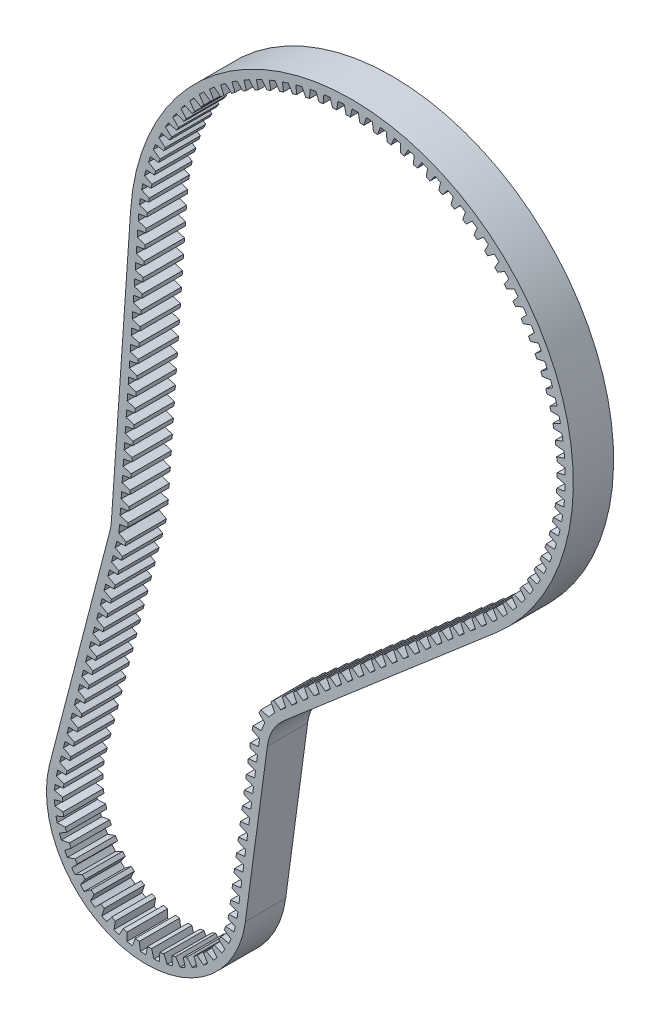
from build123d import *

# Parameters (mm, degrees)
EXTRUDE_THIN1_DEPTH = 5
BOSS_EXTRUDE1_DEPTH = 5
CRVPATTERN3_DEPTH   = 5


# Read off the part's stored shape, not the designer's step: CrvPattern3
with BuildPart() as part:
    # Sketch2 → Extrude-Thin1 (new body)
    with BuildSketch(Plane.XY):
        with BuildLine():
            Line((-29.826297558, -32.780485953), (-27.434820256, 1.892257256))
            ThreePointArc((-27.434820256, 1.892257256), (12.329017048, 24.581402292), (17.922768657, -20.857237681))
            Line((17.922768657, -20.857237681), (-8.437077677, -43.508436028))
            ThreePointArc((-8.437077677, -43.508436028), (-9.799602521, -45.196235319), (-10.472961909, -47.258207078))
            Line((-10.472961909, -47.258207078), (-13.194405781, -67.46367564))
            ThreePointArc((-13.194405781, -67.46367564), (-27.873227668, -77.976019521), (-37.485604932, -62.692715257))
            Line((-37.485604932, -62.692715257), (-30.004576967, -33.875260053))
            ThreePointArc((-30.004576967, -33.875260053), (-29.8900847, -33.332001562), (-29.826297558, -32.780485953))
        make_face()
        with BuildLine():
            Line((-28.82866773, -32.849295307), (-26.437190428, 1.823447901))
            ThreePointArc((-26.437190428, 1.823447901), (11.880689156, 23.687533117), (17.271031615, -20.098792674))
            Line((17.271031615, -20.098792674), (-9.088814719, -42.749991021))
            ThreePointArc((-9.088814719, -42.749991021), (-10.678427037, -44.719090195), (-11.46401299, -47.124723913))
            Line((-11.46401299, -47.124723913), (-14.185456862, -67.330192476))
            ThreePointArc((-14.185456862, -67.330192476), (-27.68050279, -76.994766688), (-36.517688339, -62.943986962))
            Line((-36.517688339, -62.943986962), (-29.036660374, -34.126531758))
            ThreePointArc((-29.036660374, -34.126531758), (-28.903086063, -33.492730185), (-28.82866773, -32.849295307))
        make_face(mode=Mode.SUBTRACT)
    extrude(amount=EXTRUDE_THIN1_DEPTH)

    # Sketch3 → Boss-Extrude1 (add)
    with BuildSketch(Plane.XY.offset(5)):
        Polygon((-27.670214385, -13.378348531), (-27.739187217, -14.378348531), (-27.554674216, -14.378348531), (-26.537431008, -14.197321363), (-26.502944592, -13.697321363), (-27.485701384, -13.378348531), align=None)
    extrude(amount=-BOSS_EXTRUDE1_DEPTH)

    # CrvPattern3 outline → CrvPattern3 (add)
    with BuildSketch(Plane.XY):
        Polygon((-27.680257906, -16.199118902), (-26.663014698, -16.018091734), (-26.628528282, -15.518091734), (-27.611285074, -15.199118902), align=None)
        Polygon((-26.377360903, -11.876550992), (-27.360117695, -11.55757816), (-27.429090527, -12.55757816), (-26.411847319, -12.376550992), align=None)
        Polygon((-26.251777213, -10.055780621), (-27.234534005, -9.736807789), (-27.303506837, -10.736807789), (-26.28626363, -10.555780621), align=None)
        Polygon((-26.126193524, -8.23501025), (-27.108950316, -7.916037418), (-27.177923148, -8.916037418), (-26.16067994, -8.73501025), align=None)
        Polygon((-26.000609835, -6.414239879), (-26.983366626, -6.095267047), (-27.052339458, -7.095267047), (-26.035096251, -6.914239879), align=None)
        Polygon((-25.875026145, -4.593469508), (-26.857782937, -4.274496676), (-26.926755769, -5.274496676), (-25.909512561, -5.093469508), align=None)
        Polygon((-25.749442456, -2.772699137), (-26.732199248, -2.453726305), (-26.80117208, -3.453726305), (-25.783928872, -3.272699137), align=None)
        Polygon((-25.623858766, -0.951928767), (-26.606615558, -0.632955934), (-26.67558839, -1.632955934), (-25.658345182, -1.451928767), align=None)
        Polygon((-25.498275077, 0.868841604), (-26.481031869, 1.187814437), (-26.550004701, 0.187814437), (-25.532761493, 0.368841604), align=None)
        with BuildLine():
            Line((-25.361970648, 2.638694602), (-26.331862427, 2.980439747))
            ThreePointArc((-26.331862427, 2.980439747), (-26.383410467, 2.483073122), (-26.425564894, 1.984822418))
            Line((-26.425564894, 1.984822418), (-25.408908987, 2.139709527))
            Line((-25.408908987, 2.139709527), (-25.361970648, 2.638694602))
        make_face()
        with BuildLine():
            Line((-25.131142457, 4.314851462), (-26.07623503, 4.720165953))
            ThreePointArc((-26.07623503, 4.720165953), (-26.160654158, 4.22731286), (-26.235758984, 3.732954665))
            Line((-26.235758984, 3.732954665), (-25.211069366, 3.820077774))
            Line((-25.211069366, 3.820077774), (-25.131142457, 4.314851462))
        make_face()
        with BuildLine():
            Line((-24.789662351, 5.972010118), (-25.705794494, 6.439109363))
            ThreePointArc((-25.705794494, 6.439109363), (-25.822713014, 5.952939825), (-25.930437554, 5.464650788))
            Line((-25.930437554, 5.464650788), (-24.902225913, 5.483626296))
            Line((-24.902225913, 5.483626296), (-24.789662351, 5.972010118))
        make_face()
        with BuildLine():
            Line((-24.33903386, 7.602874133), (-25.222171862, 8.129701504))
            ThreePointArc((-25.222171862, 8.129701504), (-25.371074984, 7.652356115), (-25.510944929, 7.172286163))
            Line((-25.510944929, 7.172286163), (-24.483738459, 7.123030521))
            Line((-24.483738459, 7.123030521), (-24.33903386, 7.602874133))
        make_face()
        with BuildLine():
            Line((-23.781241092, 9.200262847), (-24.627496513, 9.784498733))
            ThreePointArc((-24.627496513, 9.784498733), (-24.807728621, 9.318079235), (-24.979128126, 8.848342107))
            Line((-24.979128126, 8.848342107), (-23.957449598, 8.731072187))
            Line((-23.957449598, 8.731072187), (-23.781241092, 9.200262847))
        make_face()
        with BuildLine():
            Line((-23.118739998, 10.757142988), (-23.924386793, 11.39621501))
            ThreePointArc((-23.924386793, 11.39621501), (-24.135154327, 10.94277504), (-24.337328724, 10.485438978))
            Line((-24.337328724, 10.485438978), (-23.325676567, 10.300671116))
            Line((-23.325676567, 10.300671116), (-23.118739998, 10.757142988))
        make_face()
        with BuildLine():
            Line((-22.354447556, 12.266659644), (-23.115938478, 12.957753982))
            ThreePointArc((-23.115938478, 12.957753982), (-23.356313434, 12.519290026), (-23.588372553, 12.076368672))
            Line((-23.588372553, 12.076368672), (-22.591201051, 11.824916398))
            Line((-22.591201051, 11.824916398), (-22.354447556, 12.266659644))
        make_face()
        with BuildLine():
            Line((-21.49172893, 13.722166445), (-22.205711151, 14.462240223))
            ThreePointArc((-22.205711151, 14.462240223), (-22.474635162, 14.040682829), (-22.735557251, 13.614126357))
            Line((-22.735557251, 13.614126357), (-21.757256931, 13.297096811))
            Line((-21.757256931, 13.297096811), (-21.49172893, 13.722166445))
        make_face()
        with BuildLine():
            Line((-20.534382654, 15.117254823), (-21.197712524, 15.903049511))
            ThreePointArc((-21.197712524, 15.903049511), (-21.494001523, 15.500254788), (-21.782637748, 15.091941318))
            Line((-21.782637748, 15.091941318), (-20.827516046, 14.710730374))
            Line((-20.827516046, 14.710730374), (-20.534382654, 15.117254823))
        make_face()
        with BuildLine():
            Line((-19.486623904, 16.445782231), (-20.096380794, 17.273837992))
            ThreePointArc((-20.096380794, 17.273837992), (-20.418730227, 16.891579437), (-20.733809728, 16.503306764))
            Line((-20.733809728, 16.503306764), (-19.806072026, 16.059592886))
            Line((-19.806072026, 16.059592886), (-19.486623904, 16.445782231))
        make_face()
        with BuildLine():
            Line((-18.35306594, 17.701899191), (-18.906565104, 18.568570111))
            ThreePointArc((-18.906565104, 18.568570111), (-19.253555673, 18.208530801), (-19.593691161, 17.842008482))
            Line((-19.593691161, 17.842008482), (-18.697422269, 17.337745334))
            Line((-18.697422269, 17.337745334), (-18.35306594, 17.701899191))
        make_face()
        with BuildLine():
            Line((-17.138699796, 18.880075044), (-17.633504187, 19.781545189))
            ThreePointArc((-17.633504187, 19.781545189), (-18.0036081, 19.445310369), (-18.367301965, 19.102152195))
            Line((-18.367301965, 19.102152195), (-17.506448137, 18.539560037))
            Line((-17.506448137, 18.539560037), (-17.138699796, 18.880075044))
        make_face()
        with BuildLine():
            Line((-15.8488723, 19.975122306), (-16.282803306, 20.907422521))
            ThreePointArc((-16.282803306, 20.907422521), (-16.674391002, 20.596472627), (-17.060041908, 20.278189516))
            Line((-17.060041908, 20.278189516), (-16.238393467, 19.65974543))
            Line((-16.238393467, 19.65974543), (-15.8488723, 19.975122306))
        make_face()
        with BuildLine():
            Line((-14.489262539, 20.982219506), (-14.860409569, 21.941244892))
            ThreePointArc((-14.860409569, 21.941244892), (-15.271756896, 21.65694903), (-15.67766683, 21.364942377))
            Line((-15.67766683, 21.364942377), (-14.898841476, 20.693369359))
            Line((-14.898841476, 20.693369359), (-14.489262539, 20.982219506))
        make_face()
        with BuildLine():
            Line((-13.065856846, 21.896932416), (-13.372585748, 22.878460403))
            ThreePointArc((-13.372585748, 22.878460403), (-13.801881551, 22.622070322), (-14.226263299, 22.357625825))
            Line((-14.226263299, 22.357625825), (-13.493690185, 21.635880799))
            Line((-13.493690185, 21.635880799), (-13.065856846, 21.896932416))
        make_face()
        with BuildLine():
            Line((-11.584922448, 22.715233572), (-11.8258827, 23.714942512))
            ThreePointArc((-11.8258827, 23.714942512), (-12.271236799, 23.487587092), (-12.712221817, 23.251869096))
            Line((-12.712221817, 23.251869096), (-12.029126448, 22.48312989))
            Line((-12.029126448, 22.48312989), (-11.584922448, 22.715233572))
        make_face()
        with BuildLine():
            Line((-10.052979869, 23.433520011), (-10.227110528, 24.447008206))
            ThreePointArc((-10.227110528, 24.447008206), (-10.686562037, 24.249688489), (-11.142208678, 24.043734855))
            Line((-11.142208678, 24.043734855), (-10.511598709, 23.231386212))
            Line((-10.511598709, 23.231386212), (-10.052979869, 23.433520011))
        make_face()
        with BuildLine():
            Line((-8.476774222, 24.048629132), (-8.583308594, 25.071434214))
            ThreePointArc((-8.583308594, 25.071434214), (-9.054834558, 24.905018994), (-9.523136617, 24.729736532))
            Line((-9.523136617, 24.729736532), (-8.947788612, 23.877355208))
            Line((-8.947788612, 23.877355208), (-8.476774222, 24.048629132))
        make_face()
        with BuildLine():
            Line((-6.863245508, 24.557852623), (-6.901714525, 25.585471201))
            ThreePointArc((-6.901714525, 25.585471201), (-7.383238824, 25.450693202), (-7.862134378, 25.306853677))
            Line((-7.862134378, 25.306853677), (-7.344581581, 24.418192688))
            Line((-7.344581581, 24.418192688), (-6.863245508, 24.557852623))
        make_face()
        with BuildLine():
            Line((-5.219498062, 24.958948382), (-5.189732345, 25.986855873))
            ThreePointArc((-5.189732345, 25.986855873), (-5.679134838, 25.884308518), (-6.166515319, 25.772545253))
            Line((-6.166515319, 25.772545253), (-5.709036506, 24.851517357))
            Line((-5.709036506, 24.851517357), (-5.219498062, 24.958948382))
        make_face()
        with BuildLine():
            Line((-3.552769271, 25.250150393), (-3.454899879, 26.27382094))
            ThreePointArc((-3.454899879, 26.27382094), (-3.950025736, 26.203955745), (-4.443745217, 26.12476083))
            Line((-4.443745217, 26.12476083), (-4.048354657, 25.175421294))
            Line((-4.048354657, 25.175421294), (-3.552769271, 25.250150393))
        make_face()
        with BuildLine():
            Line((-1.870397708, 25.430176499), (-1.704855557, 26.445102902))
            ThreePointArc((-1.704855557, 26.445102902), (-2.20352475, 26.40822748), (-2.701409394, 26.361949611))
            Line((-2.701409394, 26.361949611), (-2.369847984, 25.388478357))
            Line((-2.369847984, 25.388478357), (-1.870397708, 25.430176499))
        make_face()
        with BuildLine():
            Line((-0.179790822, 25.498234049), (0.052695209, 26.499947607))
            ThreePointArc((0.052695209, 26.499947607), (-0.447321688, 26.496224321), (-0.94717932, 26.483067257))
            Line((-0.94717932, 26.483067257), (-0.680906918, 25.48975046))
            Line((-0.680906918, 25.48975046), (-0.179790822, 25.498234049))
        make_face()
        with BuildLine():
            Line((1.511607679, 25.454023387), (1.810013959, 26.438113576))
            ThreePointArc((1.810013959, 26.438113576), (1.310850922, 26.467558819), (0.811221166, 26.48758049))
            Line((0.811221166, 26.48758049), (1.011032167, 25.478791704))
            Line((1.011032167, 25.478791704), (1.511607679, 25.454023387))
        make_face()
        with BuildLine():
            Line((3.196350603, 25.297739171), (3.559363254, 26.259873062))
            ThreePointArc((3.559363254, 26.259873062), (3.063251882, 26.322357187), (2.566049862, 26.375469438))
            Line((2.566049862, 26.375469438), (2.698519698, 25.355650341))
            Line((2.698519698, 25.355650341), (3.196350603, 25.297739171))
        make_face()
        with BuildLine():
            Line((4.867020058, 25.030069518), (5.293040745, 25.966010854))
            ThreePointArc((5.293040745, 25.966010854), (4.802165405, 26.061258746), (4.309580291, 26.147227725))
            Line((4.309580291, 26.147227725), (4.374125701, 25.120868558))
            Line((4.374125701, 25.120868558), (4.867020058, 25.030069518))
        make_face()
        with BuildLine():
            Line((6.516260123, 24.652192973), (7.003413083, 25.557820822))
            ThreePointArc((7.003413083, 25.557820822), (6.519935091, 25.685413106), (6.034135725, 25.803860293))
            Line((6.034135725, 25.803860293), (6.030472517, 24.775480096))
            Line((6.030472517, 24.775480096), (6.516260123, 24.652192973))
        make_face()
        with BuildLine():
            Line((8.136809225, 24.165773317), (8.682949534, 25.037100219))
            ThreePointArc((8.682949534, 25.037100219), (8.208997632, 25.196475108), (7.73212298, 25.346878984))
            Line((7.73212298, 25.346878984), (7.660267283, 24.321005693))
            Line((7.660267283, 24.321005693), (8.136809225, 24.165773317))
        make_face()
        with BuildLine():
            Line((9.721532119, 23.572952246), (10.324255133, 24.406141767))
            ThreePointArc((10.324255133, 24.406141767), (9.861916123, 24.596597536), (9.396065854, 24.778295875))
            Line((9.396065854, 24.778295875), (9.256334046, 23.75944639))
            Line((9.256334046, 23.75944639), (9.721532119, 23.572952246))
        make_face()
        with BuildLine():
            Line((11.263451303, 22.876339941), (11.920103244, 23.667723563))
            ThreePointArc((11.920103244, 23.667723563), (11.471412795, 23.88842164), (11.018638038, 24.100614427))
            Line((11.018638038, 24.100614427), (10.811645357, 23.093274723))
            Line((10.811645357, 23.093274723), (11.263451303, 22.876339941))
        make_face()
        with BuildLine():
            Line((12.755777737, 22.07900357), (13.46346738, 22.825096848))
            ThreePointArc((13.46346738, 22.825096848), (13.030401067, 23.075065504), (12.59269538, 23.316818459))
            Line((12.59269538, 23.316818459), (12.31935321, 22.325423831))
            Line((12.31935321, 22.325423831), (12.755777737, 22.07900357))
        make_face()
        with BuildLine():
            Line((14.191940738, 21.184453791), (14.94755214, 21.88197169))
            ThreePointArc((14.94755214, 21.88197169), (14.532016746, 22.160110318), (14.111307338, 22.430359008))
            Line((14.111307338, 22.430359008), (13.772819199, 21.459274547))
            Line((13.772819199, 21.459274547), (14.191940738, 21.184453791))
        make_face()
        with BuildLine():
            Line((15.56561691, 20.196629287), (16.365823128, 20.84250065))
            ThreePointArc((16.365823128, 20.84250065), (15.969648246, 21.147584611), (15.567787493, 21.445139136))
            Line((15.567787493, 21.445139136), (15.165643741, 20.498640508))
            Line((15.165643741, 20.498640508), (15.56561691, 20.196629287))
        make_face()
        with BuildLine():
            Line((16.870757982, 19.119879431), (17.712035726, 19.711260499))
            ThreePointArc((17.712035726, 19.711260499), (17.336965707, 20.041946514), (16.955722993, 20.365496748))
            Line((16.955722993, 20.365496748), (16.491694259, 19.447751367))
            Line((16.491694259, 19.447751367), (16.870757982, 19.119879431))
        make_face()
        with BuildLine():
            Line((18.101617447, 17.958945129), (18.980262586, 18.493232064))
            ThreePointArc((18.980262586, 18.493232064), (18.627948855, 18.84806413), (18.269002785, 19.196185487))
            Line((18.269002785, 19.196185487), (17.745132178, 18.311234167))
            Line((17.745132178, 18.311234167), (18.101617447, 17.958945129))
        make_face()
        with BuildLine():
            Line((19.252775853, 16.718937953), (20.164919732, 17.1937783))
            ThreePointArc((20.164919732, 17.1937783), (19.836913519, 17.571194098), (19.501844525, 17.942353807))
            Line((19.501844525, 17.942353807), (18.920438637, 17.094092972))
            Line((18.920438637, 17.094092972), (19.252775853, 16.718937953))
        make_face()
        with BuildLine():
            Line((20.319164675, 15.405317629), (21.260791141, 15.818620675))
            ThreePointArc((21.260791141, 15.818620675), (20.958536652, 16.216958451), (20.648820035, 16.609522303))
            Line((20.648820035, 16.609522303), (20.012438785, 15.801686828))
            Line((20.012438785, 15.801686828), (20.319164675, 15.405317629))
        make_face()
        with BuildLine():
            Line((21.296088623, 14.023868002), (22.263051714, 14.373813982))
            ThreePointArc((22.263051714, 14.373813982), (21.987879768, 14.791319863), (21.704879206, 15.203559407))
            Line((21.704879206, 15.203559407), (21.016324568, 14.439706175))
            Line((21.016324568, 14.439706175), (21.296088623, 14.023868002))
        make_face()
        with BuildLine():
            Line((22.17924632, 12.580671565), (23.167288518, 12.865719674))
            ThreePointArc((23.167288518, 12.865719674), (22.920410693, 13.30055539), (22.66537223, 13.730655544))
            Line((22.66537223, 13.730655544), (21.927675895, 13.014147786))
            Line((21.927675895, 13.014147786), (22.17924632, 12.580671565))
        make_face()
        with BuildLine():
            Line((22.964749242, 11.082082684), (23.969520216, 11.300977862))
            ThreePointArc((23.969520216, 11.300977862), (23.752023509, 11.751228839), (23.526070075, 12.197295881))
            Line((23.526070075, 12.197295881), (22.742480106, 11.531288366))
            Line((22.742480106, 11.531288366), (22.964749242, 11.082082684))
        make_face()
        with BuildLine():
            Line((23.649138834, 9.534699616), (24.666214598, 9.686478071))
            ThreePointArc((24.666214598, 9.686478071), (24.479056643, 10.150161864), (24.283183107, 10.610231769))
            Line((24.283183107, 10.610231769), (23.457149635, 9.997656914))
            Line((23.457149635, 9.997656914), (23.649138834, 9.534699616))
        make_face()
        with BuildLine():
            Line((24.229401743, 7.945335457), (25.254304133, 8.029328911))
            ThreePointArc((25.254304133, 8.029328911), (25.098308983, 8.50440393), (24.933377771, 8.97645102))
            Line((24.933377771, 8.97645102), (24.068537804, 8.420005981))
            Line((24.068537804, 8.420005981), (24.229401743, 7.945335457))
        make_face()
        with BuildLine():
            Line((24.702983083, 6.320988145), (25.731199474, 6.336826778))
            ThreePointArc((25.731199474, 6.336826778), (25.607053972, 6.821201276), (25.473791274, 7.303147138))
            Line((25.473791274, 7.303147138), (24.573952686, 6.80528193))
            Line((24.573952686, 6.80528193), (24.702983083, 6.320988145))
        make_face()
        with BuildLine():
            Line((25.067797685, 4.66880965), (26.094800861, 4.616423724))
            ThreePointArc((26.094800861, 4.616423724), (26.003051618, 5.107965011), (25.902044186, 5.597687645))
            Line((25.902044186, 5.597687645), (24.971168948, 5.160594359))
            Line((24.971168948, 5.160594359), (25.067797685, 4.66880965))
        make_face()
        with BuildLine():
            Line((25.322239278, 2.99607448), (26.343507365, 2.875694649))
            ThreePointArc((26.343507365, 2.875694649), (26.28455835, 3.372238477), (26.216250918, 3.867581646))
            Line((26.216250918, 3.867581646), (25.258437654, 3.493184796))
            Line((25.258437654, 3.493184796), (25.322239278, 2.99607448))
        make_face()
        with BuildLine():
            Line((25.46518756, 1.310147654), (26.476223935, 1.122303948))
            ThreePointArc((26.476223935, 1.122303948), (26.4503347, 1.621664046), (26.415028024, 2.120446763))
            Line((26.415028024, 2.120446763), (25.434493968, 1.810394809))
            Line((25.434493968, 1.810394809), (25.46518756, 1.310147654))
        make_face()
        with BuildLine():
            Line((25.496013133, -0.381547725), (26.492366223, -0.636028234))
            ThreePointArc((26.492366223, -0.636028234), (26.499650757, -0.136050539), (26.497500293, 0.363975596))
            Line((26.497500293, 0.363975596), (25.498562715, 0.119633691))
            Line((25.498562715, 0.119633691), (25.496013133, -0.381547725))
        make_face()
        with BuildLine():
            Line((25.414580272, -2.071563158), (26.391863155, -2.391559997))
            ThreePointArc((26.391863155, -2.391559997), (26.432289385, -1.893166097), (26.4633046, -1.394098149))
            Line((26.4633046, -1.394098149), (25.450361803, -1.571654172))
            Line((25.450361803, -1.571654172), (25.414580272, -2.071563158))
        make_face()
        with BuildLine():
            Line((25.221247526, -3.75245754), (26.175157244, -4.13656177))
            ThreePointArc((26.175157244, -4.13656177), (26.248547174, -3.641946083), (26.312591509, -3.146033708))
            Line((26.312591509, -3.146033708), (25.29010346, -3.256022073))
            Line((25.29010346, -3.256022073), (25.221247526, -3.75245754))
        make_face()
        with BuildLine():
            Line((24.916866133, -5.416829927), (25.843202641, -5.863350344))
            ThreePointArc((25.843202641, -5.863350344), (25.949233137, -5.374690652), (26.046024606, -4.884117343))
            Line((26.046024606, -4.884117343), (25.018493299, -4.926053774))
            Line((25.018493299, -4.926053774), (24.916866133, -5.416829927))
        make_face()
        with BuildLine():
            Line((24.502776279, -7.05735212), (25.397460937, -7.564322704))
            ThreePointArc((25.397460937, -7.564322704), (25.535665148, -7.083770567), (25.66477758, -6.600696308))
            Line((25.66477758, -6.600696308), (24.636727216, -6.57439616))
            Line((24.636727216, -6.57439616), (24.502776279, -7.05735212))
        make_face()
        with BuildLine():
            Line((23.980801194, -8.666800934), (24.839894722, -9.231989504))
            ThreePointArc((24.839894722, -9.231989504), (25.009664139, -8.761660783), (25.170529055, -8.28821254))
            Line((25.170529055, -8.28821254), (24.146486117, -8.193791611))
            Line((24.146486117, -8.193791611), (23.980801194, -8.666800934))
        make_face()
        with BuildLine():
            Line((23.353239123, -10.238089997), (24.17295895, -10.859008039))
            ThreePointArc((24.17295895, -10.859008039), (24.37354608, -10.400973583), (24.565455195, -9.939235939))
            Line((24.565455195, -9.939235939), (23.549928525, -9.777109963))
            Line((23.549928525, -9.777109963), (23.353239123, -10.238089997))
        make_face()
        with BuildLine():
            Line((22.62285321, -11.764300956), (23.399590126, -12.43821458))
            ThreePointArc((23.399590126, -12.43821458), (23.630111789, -11.994491104), (23.852220131, -11.546497081))
            Line((23.852220131, -11.546497081), (22.849681071, -11.317379896))
            Line((22.849681071, -11.317379896), (22.62285321, -11.764300956))
        make_face()
        with BuildLine():
            Line((21.792859328, -13.238713934), (22.523193377, -13.962655912))
            ThreePointArc((22.523193377, -13.962655912), (22.78263459, -13.535197122), (23.03396422, -13.102919229))
            Line((23.03396422, -13.102919229), (22.048826931, -12.807819632))
            Line((22.048826931, -12.807819632), (21.792859328, -13.238713934))
        make_face()
        with BuildLine():
            Line((20.866911925, -14.654837121), (21.547627459, -15.425619951))
            ThreePointArc((21.547627459, -15.425619951), (21.834845909, -15.01630794), (22.114290228, -14.601649487))
            Line((22.114290228, -14.601649487), (21.150892248, -14.241866797))
            Line((21.150892248, -14.241866797), (20.866911925, -14.654837121))
        make_face()
        with BuildLine():
            Line((19.849087928, -16.006435355), (20.477187772, -16.820665295))
            ThreePointArc((20.477187772, -16.820665295), (20.79091884, -16.431302255), (21.09724746, -16.036088975))
            Line((21.09724746, -16.036088975), (20.159830613, -15.613207307))
            Line((20.159830613, -15.613207307), (19.849087928, -16.006435355))
        make_face()
        with BuildLine():
            Line((18.743868796, -17.287557575), (19.316587437, -18.141649588))
            ThreePointArc((19.316587437, -18.141649588), (19.655449773, -17.773949877), (19.987313936, -17.399921886))
            Line((19.987313936, -17.399921886), (19.080005648, -16.91580318))
            Line((19.080005648, -16.91580318), (18.743868796, -17.287557575))
        make_face()
        with BuildLine():
            Line((17.556120786, -18.492563027), (18.070936557, -19.382756562))
            ThreePointArc((18.070936557, -19.382756562), (18.433438156, -19.038339154), (18.78937667, -18.687143291))
            Line((18.78937667, -18.687143291), (17.916171801, -18.143919112))
            Line((17.916171801, -18.143919112), (17.556120786, -18.492563027))
        make_face()
        with BuildLine():
            Line((16.282072413, -19.626992536), (16.745296124, -20.55056082))
            Line((16.745296124, -20.55056082), (17.271031615, -20.098792674))
            ThreePointArc((17.271031615, -20.098792674), (17.387825723, -19.997837799), (17.504029728, -19.896204243))
            Line((17.504029728, -19.896204243), (16.662195875, -19.300349816))
            Line((16.662195875, -19.300349816), (16.282072413, -19.626992536))
        make_face()
        Polygon((14.897837341, -20.816475311), (15.361061052, -21.740043595), (16.121307975, -21.086758153), (15.277960803, -20.489832591), align=None)
        Polygon((13.513602269, -22.005958087), (13.97682598, -22.92952637), (14.737072903, -22.276240929), (13.893725731, -21.679315366), align=None)
        Polygon((12.129367198, -23.195440862), (12.592590908, -24.119009145), (13.352837831, -23.465723704), (12.509490659, -22.868798141), align=None)
        Polygon((10.745132126, -24.384923637), (11.208355836, -25.30849192), (11.968602759, -24.655206479), (11.125255587, -24.058280916), align=None)
        Polygon((9.360897054, -25.574406412), (9.824120764, -26.497974696), (10.584367687, -25.844689254), (9.741020515, -25.247763692), align=None)
        Polygon((7.976661982, -26.763889188), (8.439885693, -27.687457471), (9.200132615, -27.03417203), (8.356785443, -26.437246467), align=None)
        Polygon((6.59242691, -27.953371963), (7.055650621, -28.876940246), (7.815897544, -28.223654805), (6.972550372, -27.626729242), align=None)
        Polygon((5.208191838, -29.142854738), (5.671415549, -30.066423021), (6.431662472, -29.41313758), (5.5883153, -28.816212017), align=None)
        Polygon((3.823956766, -30.332337513), (4.287180477, -31.255905796), (5.0474274, -30.602620355), (4.204080228, -30.005694793), align=None)
        Polygon((2.439721695, -31.521820288), (2.902945405, -32.445388572), (3.663192328, -31.79210313), (2.819845156, -31.195177568), align=None)
        Polygon((1.055486623, -32.711303064), (1.518710333, -33.634871347), (2.278957256, -32.981585906), (1.435610084, -32.384660343), align=None)
        Polygon((-0.328748449, -33.900785839), (0.134475261, -34.824354122), (0.894722184, -34.171068681), (0.051375012, -33.574143118), align=None)
        Polygon((-1.712983521, -35.090268614), (-1.24975981, -36.013836897), (-0.489512887, -35.360551456), (-1.332860059, -34.763625893), align=None)
        Polygon((-3.097218593, -36.279751389), (-2.633994882, -37.203319673), (-1.873747959, -36.550034231), (-2.717095131, -35.953108669), align=None)
        Polygon((-4.481453665, -37.469234164), (-4.018229954, -38.392802448), (-3.257983031, -37.739517006), (-4.101330203, -37.142591444), align=None)
        Polygon((-5.865688736, -38.65871694), (-5.402465026, -39.582285223), (-4.642218103, -38.928999782), (-5.485565275, -38.332074219), align=None)
        Polygon((-7.249923808, -39.848199715), (-6.786700098, -40.771767998), (-6.026453175, -40.118482557), (-6.869800347, -39.521556994), align=None)
        Polygon((-8.63415888, -41.03768249), (-8.17093517, -41.961250773), (-7.410688247, -41.307965332), (-8.254035419, -40.711039769), align=None)
        with BuildLine():
            Line((-9.562373934, -43.17095902), (-9.549487111, -43.183538218))
            ThreePointArc((-9.549487111, -43.183538218), (-9.324050949, -42.961558011), (-9.088814719, -42.749991021))
            Line((-9.088814719, -42.749991021), (-8.808656042, -42.509248732))
            Line((-8.808656042, -42.509248732), (-8.81450316, -42.503541193))
            Line((-8.81450316, -42.503541193), (-9.668888682, -41.922524876))
            Line((-9.668888682, -41.922524876), (-10.042824069, -42.25623379))
            Line((-10.042824069, -42.25623379), (-9.562373934, -43.17095902))
        make_face()
        with BuildLine():
            Line((-10.79526048, -44.903629382), (-10.779197625, -44.911771317))
            ThreePointArc((-10.779197625, -44.911771317), (-10.537807086, -44.472177618), (-10.265561918, -44.050995258))
            Line((-10.265561918, -44.050995258), (-10.281623552, -44.042853942))
            Line((-10.281623552, -44.042853942), (-11.270808224, -43.744410874))
            Line((-11.270808224, -43.744410874), (-11.527626688, -44.174798593))
            Line((-11.527626688, -44.174798593), (-10.79526048, -44.903629382))
        make_face()
        with BuildLine():
            Line((-11.452589604, -46.926022577), (-11.434825542, -46.928979691))
            ThreePointArc((-11.434825542, -46.928979691), (-11.336180987, -46.437267108), (-11.202583831, -45.95387926))
            Line((-11.202583831, -45.95387926), (-11.220346543, -45.950922371))
            Line((-11.220346543, -45.950922371), (-12.253507514, -45.962454361))
            Line((-12.253507514, -45.962454361), (-12.369629045, -46.450004464))
            Line((-12.369629045, -46.450004464), (-11.452589604, -46.926022577))
        make_face()
        Polygon((-12.654617527, -48.455034819), (-11.694661977, -48.83718652), (-11.560861683, -47.843780896), (-12.58771738, -47.958332008), align=None)
        Polygon((-12.898237139, -50.263798345), (-11.938281589, -50.645950045), (-11.804481295, -49.652544422), (-12.831336992, -49.767095533), align=None)
        Polygon((-13.141856751, -52.07256187), (-12.181901201, -52.454713571), (-12.048100907, -51.461307947), (-13.074956604, -51.575859059), align=None)
        Polygon((-13.385476363, -53.881325396), (-12.425520813, -54.263477096), (-12.291720519, -53.270071473), (-13.318576216, -53.384622584), align=None)
        Polygon((-13.629095975, -55.690088921), (-12.669140425, -56.072240622), (-12.535340131, -55.078834998), (-13.562195828, -55.19338611), align=None)
        Polygon((-13.872715587, -57.498852447), (-12.912760037, -57.881004147), (-12.778959743, -56.887598524), (-13.80581544, -57.002149635), align=None)
        Polygon((-14.116335199, -59.307615972), (-13.15637965, -59.689767673), (-13.022579355, -58.696362049), (-14.049435052, -58.810913161), align=None)
        Polygon((-14.359954811, -61.116379498), (-13.399999262, -61.498531198), (-13.266198967, -60.505125575), (-14.293054664, -60.619676686), align=None)
        Polygon((-14.603574423, -62.925143024), (-13.643618874, -63.307294724), (-13.509818579, -62.313889101), (-14.536674276, -62.428440212), align=None)
        Polygon((-14.847194035, -64.733906549), (-13.887238486, -65.11605825), (-13.753438191, -64.122652626), (-14.780293888, -64.237203737), align=None)
        Polygon((-15.090813647, -66.542670075), (-14.130858098, -66.924821775), (-13.997057803, -65.931416152), (-15.0239135, -66.045967263), align=None)
        with BuildLine():
            Line((-15.360886771, -68.19761526), (-14.441824302, -68.644457037))
            ThreePointArc((-14.441824302, -68.644457037), (-14.328382124, -68.158952866), (-14.236276992, -67.668952792))
            Line((-14.236276992, -67.668952792), (-15.25760431, -67.70718479))
            Line((-15.25760431, -67.70718479), (-15.360886771, -68.19761526))
        make_face()
        with BuildLine():
            Line((-15.820710183, -69.656299608), (-14.977116079, -70.23309453))
            ThreePointArc((-14.977116079, -70.23309453), (-14.793699173, -69.769476511), (-14.630729269, -69.298282031))
            Line((-14.630729269, -69.298282031), (-15.646620683, -69.186318588))
            Line((-15.646620683, -69.186318588), (-15.820710183, -69.656299608))
        make_face()
        with BuildLine():
            Line((-16.489484264, -71.031777279), (-15.739600736, -71.726052506))
            ThreePointArc((-15.739600736, -71.726052506), (-15.490175383, -71.2943461), (-15.259864832, -70.852146509))
            Line((-15.259864832, -70.852146509), (-16.248352304, -70.592408766))
            Line((-16.248352304, -70.592408766), (-16.489484264, -71.031777279))
        make_face()
        with BuildLine():
            Line((-17.352747178, -72.294304402), (-16.712790005, -73.091046651))
            ThreePointArc((-16.712790005, -73.091046651), (-16.402749875, -72.700587247), (-16.110079005, -72.296944844))
            Line((-16.110079005, -72.296944844), (-17.049787091, -71.895049473))
            Line((-17.049787091, -71.895049473), (-17.352747178, -72.294304402))
        make_face()
        with BuildLine():
            Line((-18.391831388, -73.416579592), (-17.875639255, -74.298559795))
            ThreePointArc((-17.875639255, -74.298559795), (-17.51168878, -73.957790841), (-17.162986421, -73.601434148))
            Line((-17.162986421, -73.601434148), (-18.033594503, -73.066071893))
            Line((-18.033594503, -73.066071893), (-18.391831388, -73.416579592))
        make_face()
        with BuildLine():
            Line((-19.584267326, -74.374334326), (-19.203002576, -75.322480194))
            ThreePointArc((-19.203002576, -75.322480194), (-18.793011964, -75.038770613), (-18.395818593, -74.737405629))
            Line((-18.395818593, -74.737405629), (-19.178500298, -74.080153375))
            Line((-19.178500298, -74.080153375), (-19.584267326, -74.374334326))
        make_face()
        with BuildLine():
            Line((-20.904269285, -75.146857738), (-20.666176539, -76.14066619))
            ThreePointArc((-20.666176539, -76.14066619), (-20.219011589, -75.92015103), (-19.781916272, -75.68029459))
            Line((-19.781916272, -75.68029459), (-20.459746582, -74.915365019))
            Line((-20.459746582, -74.915365019), (-20.904269285, -75.146857738))
        make_face()
        with BuildLine():
            Line((-22.323293024, -75.717444477), (-22.233520892, -76.735425007))
            ThreePointArc((-22.233520892, -76.735425007), (-21.758851276, -76.582872775), (-21.291305935, -76.409711629))
            Line((-21.291305935, -76.409711629), (-21.849627179, -75.55364588))
            Line((-21.849627179, -75.55364588), (-22.323293024, -75.717444477))
        make_face()
        with BuildLine():
            Line((-23.810653011, -76.073755949), (-23.871142762, -77.093895344))
            ThreePointArc((-23.871142762, -77.093895344), (-23.379232923, -77.012604889), (-22.891347943, -76.909883543))
            Line((-22.891347943, -76.909883543), (-23.318086762, -75.98119352))
            Line((-23.318086762, -75.98119352), (-23.810653011, -76.073755949))
        make_face()
        with BuildLine():
            Line((-25.334185987, -76.208087134), (-25.543629566, -77.208325497))
            ThreePointArc((-25.543629566, -77.208325497), (-25.045116756, -77.200054677), (-24.547442356, -77.169994417))
            Line((-24.547442356, -77.169994417), (-24.83337078, -76.18876248))
            Line((-24.83337078, -76.18876248), (-25.334185987, -76.208087134))
        make_face()
        with BuildLine():
            Line((-26.860946473, -76.117533202), (-27.21481479, -77.076240984))
            ThreePointArc((-27.21481479, -77.076240984), (-26.720479048, -77.141168649), (-26.223777134, -77.18441951))
            Line((-26.223777134, -77.18441951), (-26.362712135, -76.171864207))
            Line((-26.362712135, -76.171864207), (-26.860946473, -76.117533202))
        make_face()
        with BuildLine():
            Line((-28.357919197, -75.804052327), (-28.848560063, -76.700498051))
            ThreePointArc((-28.848560063, -76.700498051), (-28.3690911, -76.837220181), (-27.884102551, -76.95284689))
            Line((-27.884102551, -76.95284689), (-27.873039744, -75.930864116))
            Line((-27.873039744, -75.930864116), (-28.357919197, -75.804052327))
        make_face()
        with BuildLine():
            Line((-29.79273303, -75.274423344), (-30.409536634, -76.089221914))
            ThreePointArc((-30.409536634, -76.089221914), (-29.955302675, -76.294781975), (-29.492515076, -76.480284174))
            Line((-29.492515076, -76.480284174), (-29.331693687, -75.470973687))
            Line((-29.331693687, -75.470973687), (-29.79273303, -75.274423344))
        make_face()
        with BuildLine():
            Line((-31.134360991, -74.540099157), (-31.863989328, -75.255631048))
            ThreePointArc((-31.863989328, -75.255631048), (-31.444812908, -75.525583928), (-31.01423376, -75.776950244))
            Line((-31.01423376, -75.776950244), (-30.707131455, -74.802137774))
            Line((-30.707131455, -74.802137774), (-31.134360991, -74.540099157))
        make_face()
        with BuildLine():
            Line((-32.353791186, -73.616959085), (-33.180466485, -74.217751351))
            ThreePointArc((-33.180466485, -74.217751351), (-32.805412041, -74.546259483), (-32.416352357, -74.858054271))
            Line((-32.416352357, -74.858054271), (-31.969610037, -73.938819547))
            Line((-31.969610037, -73.938819547), (-32.353791186, -73.616959085))
        make_face()
        with BuildLine():
            Line((-33.424654177, -72.524965471), (-34.330500084, -72.998026344))
            ThreePointArc((-34.330500084, -72.998026344), (-34.007677942, -73.377985937), (-33.668550902, -73.743466825))
            Line((-33.668550902, -73.743466825), (-33.091829099, -72.899687743))
            Line((-33.091829099, -72.899687743), (-33.424654177, -72.524965471))
        make_face()
        with BuildLine():
            Line((-34.323793198, -71.287732018), (-35.289221343, -71.622831842))
            ThreePointArc((-35.289221343, -71.622831842), (-35.025612336, -72.046026501), (-34.743751358, -72.457290185))
            Line((-34.743751358, -72.457290185), (-34.049521333, -71.707212956))
            Line((-34.049521333, -71.707212956), (-34.323793198, -71.287732018))
        make_face()
        with BuildLine():
            Line((-35.031764912, -69.93201315), (-36.035898496, -70.121905595))
            ThreePointArc((-36.035898496, -70.121905595), (-35.837203009, -70.579183991), (-35.618703166, -71.027337142))
            Line((-35.618703166, -71.027337142), (-34.821977223, -70.387181733))
            Line((-34.821977223, -70.387181733), (-35.031764912, -69.93201315))
        make_face()
        with BuildLine():
            Line((-35.533259859, -68.487125468), (-36.554385101, -68.527704224))
            ThreePointArc((-36.554385101, -68.527704224), (-36.424899804, -69.009177988), (-36.274486023, -69.484529566))
            Line((-36.274486023, -69.484529566), (-35.392492877, -68.96813895))
            Line((-35.392492877, -68.96813895), (-35.533259859, -68.487125468))
        make_face()
        with BuildLine():
            Line((-35.817433514, -66.984313793), (-36.833469199, -66.874701369))
            ThreePointArc((-36.833469199, -66.874701369), (-36.775994133, -67.369958923), (-36.69691902, -67.862229738))
            Line((-36.69691902, -67.862229738), (-35.748731241, -67.480770549))
            Line((-35.748731241, -67.480770549), (-35.817433514, -66.984313793))
        make_face()
        with BuildLine():
            Line((-35.878140794, -65.456075519), (-36.867115764, -65.198642218))
            ThreePointArc((-36.867115764, -65.198642218), (-36.882893793, -65.696973917), (-36.876867301, -66.195518909))
            Line((-36.876867301, -66.195518909), (-35.882988875, -65.957239973))
            Line((-35.882988875, -65.957239973), (-35.878140794, -65.456075519))
        make_face()
        with BuildLine():
            Line((-35.714068941, -63.935457874), (-36.654597211, -63.535770535))
            ThreePointArc((-36.654597211, -63.535770535), (-36.743287144, -64.026400257), (-36.810439592, -64.520438693))
            Line((-36.810439592, -64.520438693), (-35.792362538, -64.430492646))
            Line((-35.792362538, -64.430492646), (-35.714068941, -63.935457874))
        make_face()
        Polygon((-35.328247662, -62.351387157), (-36.235496665, -61.856964437), (-36.487365342, -62.827180609), (-35.454182001, -62.836495243), align=None)
        Polygon((-34.869652638, -60.584846297), (-35.776901641, -60.090423577), (-36.028770318, -61.060639749), (-34.995586976, -61.069954383), align=None)
        Polygon((-34.411057613, -58.818305437), (-35.318306616, -58.323882717), (-35.570175293, -59.294098889), (-34.536991952, -59.303413523), align=None)
        Polygon((-33.952462589, -57.051764577), (-34.859711592, -56.557341857), (-35.111580269, -57.527558029), (-34.078396927, -57.536872663), align=None)
        Polygon((-33.493867564, -55.285223717), (-34.401116568, -54.790800997), (-34.652985245, -55.761017169), (-33.619801903, -55.770331803), align=None)
        Polygon((-33.03527254, -53.518682857), (-33.942521543, -53.024260137), (-34.19439022, -53.994476309), (-33.161206878, -54.003790943), align=None)
        Polygon((-32.576677515, -51.752141997), (-33.483926519, -51.257719277), (-33.735795196, -52.227935449), (-32.702611854, -52.237250083), align=None)
        Polygon((-32.118082491, -49.985601137), (-33.025331494, -49.491178417), (-33.277200171, -50.461394589), (-32.24401683, -50.470709223), align=None)
        Polygon((-31.659487467, -48.219060277), (-32.56673647, -47.724637556), (-32.818605147, -48.694853729), (-31.785421805, -48.704168363), align=None)
        Polygon((-31.200892442, -46.452519417), (-32.108141445, -45.958096696), (-32.360010122, -46.928312869), (-31.326826781, -46.937627503), align=None)
        Polygon((-30.742297418, -44.685978557), (-31.649546421, -44.191555836), (-31.901415098, -45.161772009), (-30.868231756, -45.171086643), align=None)
        Polygon((-30.283702393, -42.919437696), (-31.190951396, -42.425014976), (-31.442820073, -43.395231149), (-30.409636732, -43.404545783), align=None)
        Polygon((-29.825107369, -41.152896836), (-30.732356372, -40.658474116), (-30.984225049, -41.628690289), (-29.951041707, -41.638004923), align=None)
        Polygon((-29.366512344, -39.386355976), (-30.273761347, -38.891933256), (-30.525630024, -39.862149429), (-29.492446683, -39.871464063), align=None)
        Polygon((-28.90791732, -37.619815116), (-29.815166323, -37.125392396), (-30.067035, -38.095608569), (-29.033851658, -38.104923203), align=None)
        Polygon((-28.449322295, -35.853274256), (-29.356571298, -35.358851536), (-29.608439975, -36.329067709), (-28.575256634, -36.338382343), align=None)
        with BuildLine():
            Line((-28.900150011, -33.583242571), (-28.917877538, -33.580073784))
            ThreePointArc((-28.917877538, -33.580073784), (-28.971809821, -33.854489416), (-29.036660374, -34.126531758))
            Line((-29.036660374, -34.126531758), (-29.147843611, -34.554817544))
            Line((-29.147843611, -34.554817544), (-29.144007169, -34.555503306))
            Line((-29.144007169, -34.555503306), (-28.110782144, -34.556295281))
            Line((-28.110782144, -34.556295281), (-27.988853565, -34.070164913))
            Line((-27.988853565, -34.070164913), (-28.900150011, -33.583242571))
        make_face()
        Polygon((-27.758781486, -31.905025072), (-28.741538278, -31.58605224), (-28.81051111, -32.58605224), (-27.793267902, -32.405025072), align=None)
        Polygon((-27.633197797, -30.084254701), (-28.615954589, -29.765281869), (-28.684927421, -30.765281869), (-27.667684213, -30.584254701), align=None)
        Polygon((-27.507614108, -28.26348433), (-28.490370899, -27.944511498), (-28.559343731, -28.944511498), (-27.542100524, -28.76348433), align=None)
        Polygon((-27.382030418, -26.442713959), (-28.36478721, -26.123741127), (-28.433760042, -27.123741127), (-27.416516834, -26.942713959), align=None)
        Polygon((-27.256446729, -24.621943588), (-28.239203521, -24.302970756), (-28.308176352, -25.302970756), (-27.290933145, -25.121943588), align=None)
        Polygon((-27.130863039, -22.801173218), (-28.113619831, -22.482200385), (-28.182592663, -23.482200385), (-27.165349455, -23.301173218), align=None)
        Polygon((-27.00527935, -20.980402847), (-27.988036142, -20.661430014), (-28.057008974, -21.661430014), (-27.039765766, -21.480402847), align=None)
        Polygon((-26.87969566, -19.159632476), (-27.862452452, -18.840659643), (-27.931425284, -19.840659643), (-26.914182077, -19.659632476), align=None)
        Polygon((-26.754111971, -17.338862105), (-27.736868763, -17.019889273), (-27.805841595, -18.019889273), (-26.788598387, -17.838862105), align=None)
    extrude(amount=CRVPATTERN3_DEPTH)


solid = part.part
